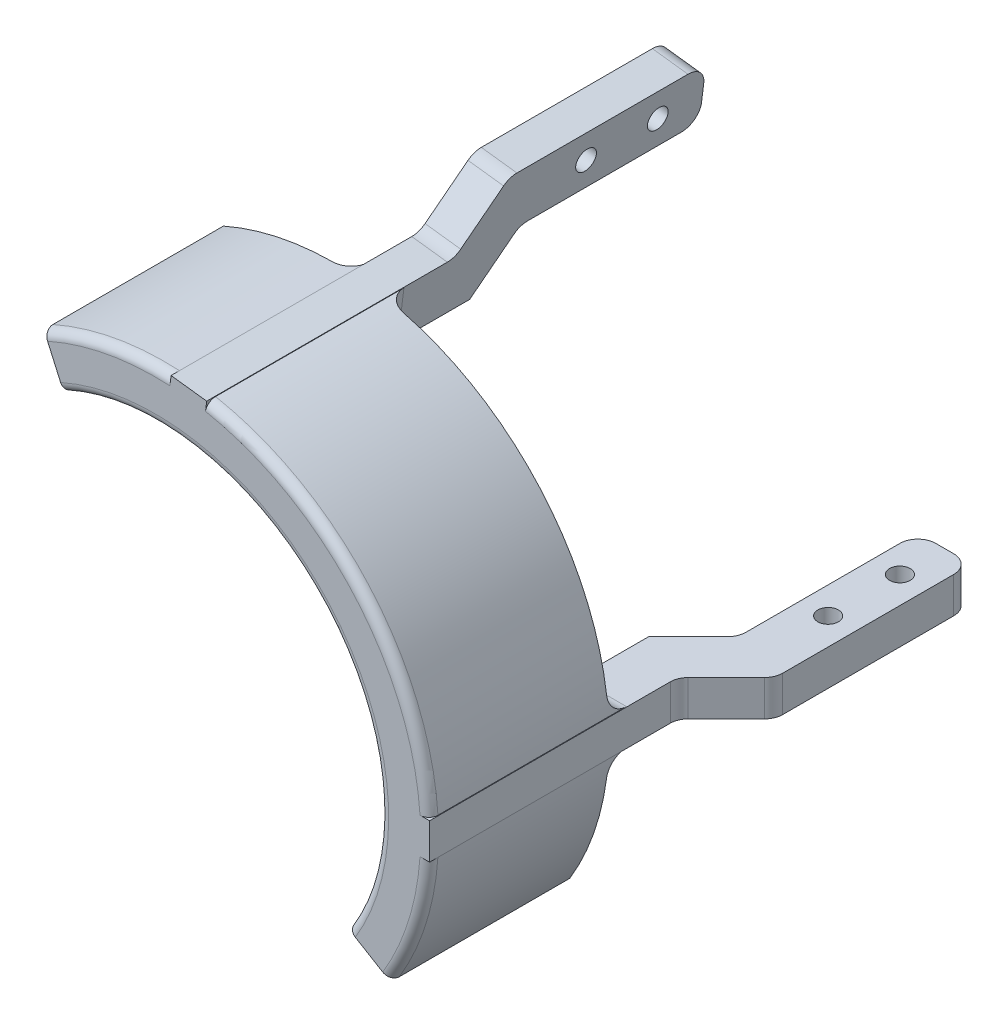
from build123d import *

# Parameters (mm, degrees)
SKETCH_1_R                       = 1.15
EXTRUDE_1_DEPTH                  = 4
FILLET_1_R                       = 2
SKETCH_2_W                       = 5.563454525
SKETCH_2_H                       = 20
REVOLVE_2_ANGLE                  = 114
REVOLVE_2_OTHER_WAY_ANGLE        = 31
PATTERN_CIRCULAR_4_COUNT         = 2
PATTERN_CIRCULAR_4_ANGLE         = 83
FILLET_1_OF_PATTERN_CIRCULAR_4_R = 2
FILLET_2_R                       = 1
FILLET_3_R                       = 2


with BuildPart() as part:
    # 草图1 → 凸台-拉伸1 (new body)
    with BuildSketch(Plane(origin=(0, 0, 0), x_dir=(1, 0, 0), z_dir=(0, 1, 0))):
        Polygon((25, 40), (25, 10), (30.563454525, 10), (30.563454525, 37.663959588), (36, 43.100505063), (36, 65), (30, 65), (30, 45), align=None)
        with Locations((33, 52)):
            Circle(SKETCH_1_R, mode=Mode.SUBTRACT)
        with Locations((33, 60)):
            Circle(SKETCH_1_R, mode=Mode.SUBTRACT)
    extrude_1 = extrude(amount=EXTRUDE_1_DEPTH)

    # 圆角1
    fillet_1_edges = [part.edges().sort_by_distance(p)[0] for p in [
        (30.563454525, 2, -37.663959588),
        (30, 2, -45),
        (36, 2, -43.100505063),
        (36, 2, -65),
        (30, 2, -65),
    ]]
    fillet(fillet_1_edges, radius=FILLET_1_R)

    # 草图2 → 旋转2 (revolve)
    with BuildSketch(Plane(origin=(0, 2, 0), x_dir=(1, 0, 0), z_dir=(0, 1, 0))):
        with Locations((27.781727262, 20)):
            Rectangle(SKETCH_2_W, SKETCH_2_H)
    revolve(axis=Axis((0, 2, -67.752835875), (0, 0, 1)), revolution_arc=REVOLVE_2_ANGLE)

    # 草图2 → 旋转2 other way (revolve)
    with BuildSketch(Plane(origin=(0, 2, 0), x_dir=(1, 0, 0), z_dir=(0, 1, 0))):
        with Locations((27.781727262, 20)):
            Rectangle(SKETCH_2_W, SKETCH_2_H)
    revolve(axis=Axis((0, 2, -67.752835875), (0, 0, -1)), revolution_arc=REVOLVE_2_OTHER_WAY_ANGLE)

    # 阵列(圆周)4: 凸台-拉伸1 ×2 about axis
    pattern_circular_4_axis = Axis((0, 2, -67.752835875), (0, 0, 1))
    for i in range(1, PATTERN_CIRCULAR_4_COUNT):
        add(extrude_1.rotate(pattern_circular_4_axis, i * PATTERN_CIRCULAR_4_ANGLE / (PATTERN_CIRCULAR_4_COUNT - 1)))

    # 圆角1 of 阵列(圆周)4
    fillet_1_of_pattern_circular_4_edges = [part.edges().sort_by_distance(p)[0] for p in [
        (3.724748135, 32.335639169, -37.663959588),
        (3.656080302, 31.776384549, -45),
        (4.387296363, 37.731661459, -43.100505063),
        (4.387296363, 37.731661459, -65),
        (3.656080302, 31.776384549, -65),
    ]]
    fillet(fillet_1_of_pattern_circular_4_edges, radius=FILLET_1_OF_PATTERN_CIRCULAR_4_R)

    # 圆角2
    fillet_2_edges = [part.edges().sort_by_distance(p)[0] for p in [
        (29.168708283, -7.127497445, -10),
        (22.890674113, 22.251957711, -10),
        (-5.504691137, 32.063651275, -10),
        (18.72389302, 18.565501205, -10),
    ]]
    fillet(fillet_2_edges, radius=FILLET_2_R)

    # 圆角3
    fillet_3_edges = [part.edges().sort_by_distance(p)[0] for p in [
        (5.366841465, 29.29839802, -30),
        (1.396656859, 29.785875394, -30),
        (27.748973347, 4, -30),
        (27.748973347, 0, -30),
    ]]
    fillet(fillet_3_edges, radius=FILLET_3_R)


solid = part.part
